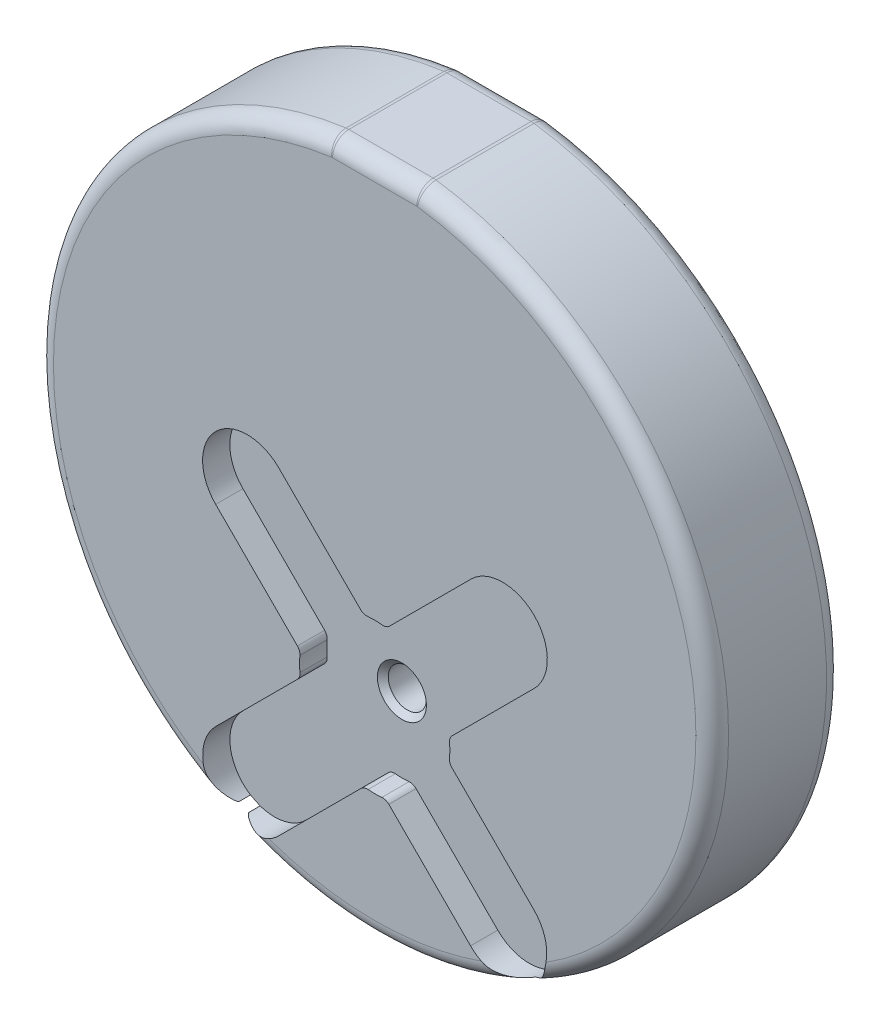
from build123d import *

# Parameters (mm, degrees)
EXTRUDE_1_DEPTH     = 12
SKETCH_2_R          = 1.75
CUT_EXTRUDE_1_DEPTH = 46.453272709
CUT_EXTRUDE_2_DEPTH = 2.5
FILLET_2_R          = 2
FILLET_3_R          = 1.5
FILLET_5_R          = 0.8
CHAMFER_2_SIZE      = 0.5


with BuildPart() as part:
    # 草图1 → 凸台-拉伸1 (new body)
    with BuildSketch(Plane.XY):
        with BuildLine():
            Line((4, 30.740852298), (-4, 30.740852298))
            ThreePointArc((-4, 30.740852298), (0, -31), (4, 30.740852298))
        make_face()
    extrude(amount=EXTRUDE_1_DEPTH)

    # 草图2 → 切除-拉伸1 (cut, through all)
    with BuildSketch(Plane.XY.offset(12)):
        with Locations((0, -12.5)):
            Circle(SKETCH_2_R)
    extrude(amount=-CUT_EXTRUDE_1_DEPTH, mode=Mode.SUBTRACT)

    # 草图4 → 切除-拉伸2 (cut)
    with BuildSketch(Plane.XY.offset(12)):
        with BuildLine():
            Line((14.60159577, -21.303320164), (6.823421177, -13.525145571))
            ThreePointArc((6.823421177, -13.525145571), (6.899952258, -12.525667942), (6.83085934, -11.525648589))
            Line((6.83085934, -11.525648589), (14.609033933, -3.747473996))
            ThreePointArc((14.609033933, -3.747473996), (14.67380701, 2.072232238), (8.853780377, 2.09382366))
            Line((8.853780377, 2.09382366), (1.075605784, -5.684350934))
            ThreePointArc((1.075605784, -5.684350934), (0.025527626, -5.600047222), (-1.025145571, -5.676578823))
            Line((-1.025145571, -5.676578823), (-8.803320164, 2.10159577))
            ThreePointArc((-8.803320164, 2.10159577), (-14.60159577, 2.10159577), (-14.60159577, -3.696679836))
            Line((-14.60159577, -3.696679836), (-6.823421177, -11.474854429))
            ThreePointArc((-6.823421177, -11.474854429), (-6.899952778, -12.525527626), (-6.815649066, -13.575605784))
            Line((-6.815649066, -13.575605784), (-14.59382366, -21.353780377))
            ThreePointArc((-14.59382366, -21.353780377), (-14.572232238, -27.17380701), (-8.752526004, -27.109033933))
            Line((-8.752526004, -27.109033933), (-0.974351411, -19.33085934))
            ThreePointArc((-0.974351411, -19.33085934), (0.025667942, -19.399952258), (1.025145571, -19.323421177))
            Line((1.025145571, -19.323421177), (8.803320164, -27.10159577))
            ThreePointArc((8.803320164, -27.10159577), (14.60159577, -27.10159577), (14.60159577, -21.303320164))
        make_face()
    extrude(amount=-CUT_EXTRUDE_2_DEPTH, mode=Mode.SUBTRACT)

    # 圆角2
    fillet_2_edges = [part.edges().sort_by_distance(p)[0] for p in [
        (-4, 30.740852298, 6),
        (4, 30.740852298, 6),
    ]]
    fillet(fillet_2_edges, radius=FILLET_2_R)

    # 圆角3
    # the kernel refuses this fillet: 1.5 mm, written as the material it takes off along each edge
    with BuildSketch(Plane(origin=(0, 0, 12), x_dir=(-0.5266668059049125, -0.8500718061187049, 0), z_dir=(-0.8500718061187049, 0.5266668059049125, 0))) as fillet_3_piece_1:
        with BuildLine():
            CenterArc((31 - FILLET_3_R, -FILLET_3_R), FILLET_3_R, 0, 90)
            Line((31, -FILLET_3_R), (31, 0))
            Line((31, 0), (31 - FILLET_3_R, 0))
        make_face()
    revolve(axis=Axis((0, 0, 12), (0, 0, 1)), revolution_arc=204.115094482, mode=Mode.SUBTRACT)
    with BuildSketch(Plane(origin=(3.868256609, 30.740852298, 0), x_dir=(0, 0, 1), z_dir=(-1, 0, 0))) as fillet_3_piece_2:
        with BuildLine():
            CenterArc((FILLET_3_R, -FILLET_3_R), FILLET_3_R, 90, 90)
            Line((0, -FILLET_3_R), (0, 0))
            Line((0, 0), (FILLET_3_R, 0))
        make_face()
    extrude(amount=7.736513218, mode=Mode.SUBTRACT)
    with BuildSketch(Plane(origin=(3.868256609, 30.740852298, 12), x_dir=(0, 0, -1), z_dir=(-1, 0, 0))) as fillet_3_piece_3:
        with BuildLine():
            CenterArc((FILLET_3_R, FILLET_3_R), FILLET_3_R, 180, 90)
            Line((0, FILLET_3_R), (0, 0))
            Line((0, 0), (FILLET_3_R, 0))
        make_face()
    extrude(amount=7.736513218, mode=Mode.SUBTRACT)
    with BuildSketch(Plane(origin=(0, 0, 0), x_dir=(-0.1333881589240954, 0.991063872340648, 0), z_dir=(0.991063872340648, 0.1333881589240954, 0))) as fillet_3_piece_4:
        with BuildLine():
            CenterArc((31 - FILLET_3_R, FILLET_3_R), FILLET_3_R, 270, 90)
            Line((31, FILLET_3_R), (31, 0))
            Line((31, 0), (31 - FILLET_3_R, 0))
        make_face()
    revolve(axis=Axis((0, 0, 0), (0, 0, 1)), revolution_arc=344.669149504, mode=Mode.SUBTRACT)
    with BuildSketch(Plane(origin=(-3.868256609, 28.740852298, 0), x_dir=(0, 1, 0), z_dir=(1, 0, 0))) as fillet_3_piece_5:
        with BuildLine():
            CenterArc((2 - FILLET_3_R, FILLET_3_R), FILLET_3_R, 270, 90)
            Line((2, FILLET_3_R), (2, 0))
            Line((2, 0), (2 - FILLET_3_R, 0))
        make_face()
    revolve(axis=Axis((-3.868256609, 28.740852298, 0), (0, 0, 1)), revolution_arc=7.665425248, mode=Mode.SUBTRACT)
    with BuildSketch(Plane(origin=(3.868256609, 28.740852298, 0), x_dir=(0, 1, 0), z_dir=(-1, 0, 0))) as fillet_3_piece_6:
        with BuildLine():
            CenterArc((2 - FILLET_3_R, -FILLET_3_R), FILLET_3_R, 0, 90)
            Line((2, -FILLET_3_R), (2, 0))
            Line((2, 0), (2 - FILLET_3_R, 0))
        make_face()
    revolve(axis=Axis((3.868256609, 28.740852298, 0), (0, 0, -1)), revolution_arc=7.665425248, mode=Mode.SUBTRACT)
    with BuildSketch(Plane(origin=(0, 0, 12), x_dir=(-0.1333881589240954, 0.991063872340648, 0), z_dir=(0.991063872340648, 0.1333881589240954, 0))) as fillet_3_piece_7:
        with BuildLine():
            CenterArc((31 - FILLET_3_R, -FILLET_3_R), FILLET_3_R, 0, 90)
            Line((31, -FILLET_3_R), (31, 0))
            Line((31, 0), (31 - FILLET_3_R, 0))
        make_face()
    revolve(axis=Axis((0, 0, 12), (0, 0, 1)), revolution_arc=152.623466515, mode=Mode.SUBTRACT)
    with BuildSketch(Plane(origin=(-3.868256609, 28.740852298, 12), x_dir=(0, 1, 0), z_dir=(1, 0, 0))) as fillet_3_piece_8:
        with BuildLine():
            CenterArc((2 - FILLET_3_R, -FILLET_3_R), FILLET_3_R, 0, 90)
            Line((2 - FILLET_3_R, 0), (2, 0))
            Line((2, 0), (2, -FILLET_3_R))
        make_face()
    revolve(axis=Axis((-3.868256609, 28.740852298, 12), (0, 0, 1)), revolution_arc=7.665425248, mode=Mode.SUBTRACT)
    with BuildSketch(Plane(origin=(3.868256609, 28.740852298, 12), x_dir=(0, 1, 0), z_dir=(-1, 0, 0))) as fillet_3_piece_9:
        with BuildLine():
            CenterArc((2 - FILLET_3_R, FILLET_3_R), FILLET_3_R, 270, 90)
            Line((2 - FILLET_3_R, 0), (2, 0))
            Line((2, 0), (2, FILLET_3_R))
        make_face()
    revolve(axis=Axis((3.868256609, 28.740852298, 12), (0, 0, -1)), revolution_arc=7.665425248, mode=Mode.SUBTRACT)

    # 圆角5
    fillet_5_edges = [part.edges().sort_by_distance(p)[0] for p in [
        (6.83085934, -11.525648589, 10.75),
        (6.823421177, -13.525145571, 10.75),
        (1.025145571, -19.323421177, 10.75),
        (-0.974351411, -19.33085934, 10.75),
        (-6.815649066, -13.575605784, 10.75),
        (-6.823421177, -11.474854429, 10.75),
        (-1.025145571, -5.676578823, 10.75),
        (1.075605784, -5.684350934, 10.75),
    ]]
    fillet(fillet_5_edges, radius=FILLET_5_R)

    # 倒角2
    chamfer_2_edges = [part.edges().sort_by_distance(p)[0] for p in [
        (-1.75, -12.5, 0),
        (-1.75, -12.5, 9.5),
    ]]
    chamfer(chamfer_2_edges, length=CHAMFER_2_SIZE)


solid = part.part
